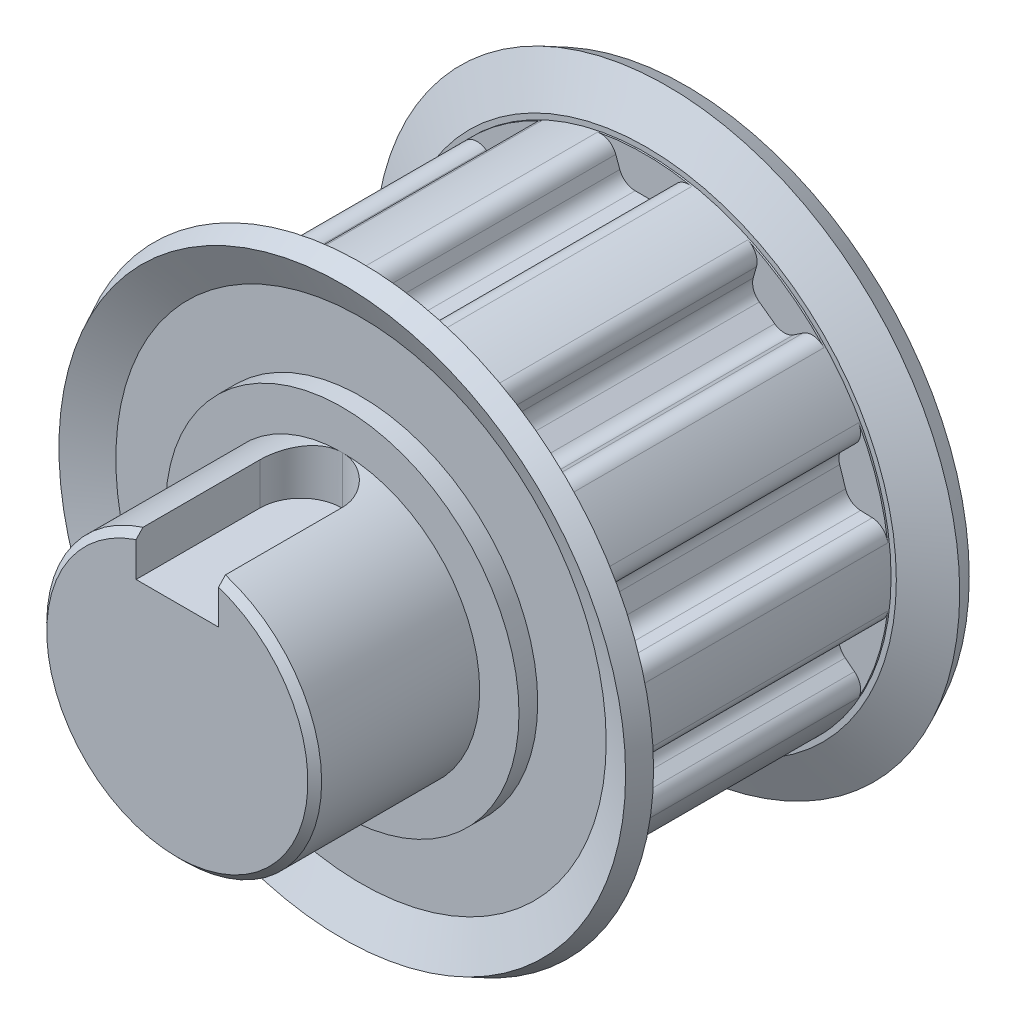
from build123d import *

# Parameters (mm, degrees)
TOOTH_EXTRUDE_START      = -9.5
TOOTH_EXTRUDE_DEPTH      = 19
PATTERN_CIRCULAR_1_COUNT = 10
SKETCH_3_R               = 10
EXTRUDE_1_DEPTH          = 12
CHAMFER_1_SIZE           = 0.5
SKETCH_4_W               = 6
SKETCH_4_H               = 7
CUT_EXTRUDE_1_DEPTH      = 12
FILLET_1_R               = 3


with BuildPart() as part:
    # GearBelt-BaseSketch → 0.375in Pitch 'L', 0.500in Belt Width, 36.3828mm P.D. (revolve)
    with BuildSketch(Plane(origin=(0, 0, 0), x_dir=(0, 0, -1), z_dir=(1, 0, 0)), mode=Mode.PRIVATE) as f_0_375in_pitch_l_0_500in_belt_width_36_sk:
        Polygon((-12.5, 0), (12.5, 0), (12.5, 12.857409477), (11.136655608, 12.857409477), (11.136655608, 17.838520326), (12.5, 20.614224723), (11.136655777, 21.283859322), (9.617735592, 18.191410003), (9.617735592, 17.810409995), (-9.617735592, 17.810409995), (-9.617735592, 18.191410003), (-11.136655777, 21.283859322), (-12.5, 20.614224723), (-11.136655608, 17.838520326), (-11.136655608, 12.857409477), (-12.5, 12.857409477), align=None)
    revolve(f_0_375in_pitch_l_0_500in_belt_width_36_sk.sketch.rotate(Axis((0, 0, 14.2875), (0, 0, -1)), 90), axis=Axis((0, 0, 14.2875), (0, 0, -1)))

    # Tooth-Sketch → Tooth-Extrude (cut)
    with BuildSketch(Plane.XY.offset(TOOTH_EXTRUDE_START)):
        with BuildLine():
            Line((-0.690315485, 15.14340994), (0.690315485, 15.14340994))
            ThreePointArc((0.690315485, 15.14340994), (1.373229902, 15.358732029), (1.809136966, 15.926817177))
            Line((1.809136966, 15.926817177), (2.101875716, 16.731110287))
            ThreePointArc((2.101875716, 16.731110287), (2.625223607, 17.348846453), (3.424464642, 17.478093321))
            Line((3.424464642, 17.478093321), (3.424464642, 20.018093321))
            Line((3.424464642, 20.018093321), (-3.424464642, 20.018093321))
            Line((-3.424464642, 20.018093321), (-3.424464642, 17.478093321))
            ThreePointArc((-3.424464642, 17.478093321), (-2.625223607, 17.348846453), (-2.101875716, 16.731110287))
            Line((-2.101875716, 16.731110287), (-1.809136966, 15.926817177))
            ThreePointArc((-1.809136966, 15.926817177), (-1.373229902, 15.358732029), (-0.690315485, 15.14340994))
        make_face()
    tooth_extrude = extrude(amount=TOOTH_EXTRUDE_DEPTH, mode=Mode.SUBTRACT)

    # 阵列(圆周)1: Tooth-Extrude ×10 about axis
    pattern_circular_1_axis = Axis((0, 0, 0), (0, 0, 1))
    for i in range(1, PATTERN_CIRCULAR_1_COUNT):
        add(tooth_extrude.rotate(pattern_circular_1_axis, i * 360 / PATTERN_CIRCULAR_1_COUNT), mode=Mode.SUBTRACT)

    # 草图3 → 凸台-拉伸1 (add)
    with BuildSketch(Plane.XY.offset(12.5)):
        with Locations(Location((0, 0, 0), (0, 0, 180))):
            Circle(SKETCH_3_R)
    extrude(amount=EXTRUDE_1_DEPTH)

    # 倒角1
    chamfer_1_edges = [part.edges().sort_by_distance(p)[0] for p in [
        (10, 0, 24.5),
    ]]
    chamfer(chamfer_1_edges, length=CHAMFER_1_SIZE)

    # 草图4 → 切除-拉伸1 (cut)
    with BuildSketch(Plane.XY.offset(24.5)):
        with Locations((0, 10)):
            Rectangle(SKETCH_4_W, SKETCH_4_H)
    extrude(amount=-CUT_EXTRUDE_1_DEPTH, mode=Mode.SUBTRACT)

    # 圆角1
    fillet_1_edges = [part.edges().sort_by_distance(p)[0] for p in [
        (-3, 8.019696007, 12.5),
        (3, 8.019696007, 12.5),
    ]]
    fillet(fillet_1_edges, radius=FILLET_1_R - 0.0001)  # a hair under: the kernel refuses the full size


solid = part.part
